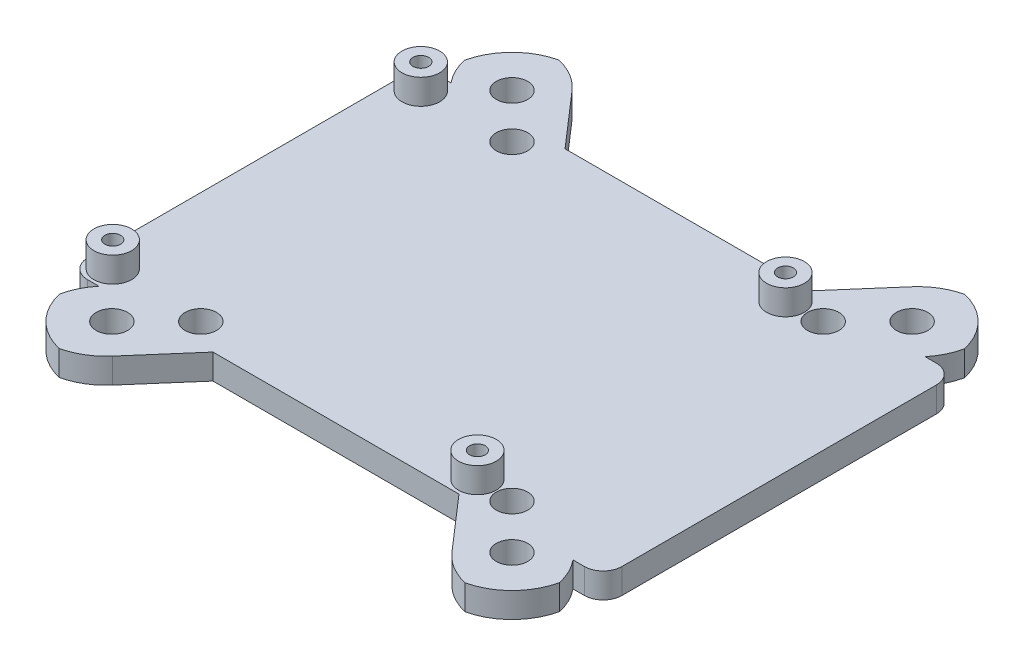
from build123d import *

# Parameters (mm, degrees)
SKETCH1_W           = 85
SKETCH1_H           = 56
SKETCH1_R           = 1.25
BOSS_EXTRUDE1_DEPTH = 4
SKETCH2_R           = 3
SKETCH2_R_2         = 1.25
BOSS_EXTRUDE2_DEPTH = 4
FILLET1_R           = 3
BOSS_EXTRUDE4_DEPTH = 4
SKETCH3_R           = 2.5
CUT_EXTRUDE1_DEPTH  = 59.5
FILLET2_R           = 10


with BuildPart() as part:
    # Sketch1 → Boss-Extrude1 (new body)
    with BuildSketch(Plane(origin=(0, 0, 0), x_dir=(1, 0, 0), z_dir=(0, 1, 0))):
        Rectangle(SKETCH1_W, SKETCH1_H)
        with Locations(Location((-39, 24.5, 0), (0, 0, 270))):
            Circle(SKETCH1_R, mode=Mode.SUBTRACT)
        with Locations(Location((-39, -24.5, 0), (0, 0, 270))):
            Circle(SKETCH1_R, mode=Mode.SUBTRACT)
        with Locations(Location((19, 24.5, 0), (0, 0, 270))):
            Circle(SKETCH1_R, mode=Mode.SUBTRACT)
        with Locations(Location((19, -24.5, 0), (0, 0, 270))):
            Circle(SKETCH1_R, mode=Mode.SUBTRACT)
    extrude(amount=BOSS_EXTRUDE1_DEPTH)

    # Sketch2 → Boss-Extrude2 (add)
    # profile 1 of 4: a face of its own
    with BuildSketch(Plane(origin=(0, 4, 0), x_dir=(1, 0, 0), z_dir=(0, 1, 0))):
        with Locations(Location((-39, 24.5, 0), (0, 0, 270))):
            Circle(SKETCH2_R)
        with Locations(Location((-39, 24.5, 0), (0, 0, 270))):
            Circle(SKETCH2_R_2, mode=Mode.SUBTRACT)
    # profile 2 of 4: a face of its own
    with BuildSketch(Plane(origin=(0, 4, 0), x_dir=(1, 0, 0), z_dir=(0, 1, 0))):
        with Locations(Location((19, 24.5, 0), (0, 0, 270))):
            Circle(SKETCH2_R)
        with Locations(Location((19, 24.5, 0), (0, 0, 270))):
            Circle(SKETCH2_R_2, mode=Mode.SUBTRACT)
    # profile 3 of 4: a face of its own
    with BuildSketch(Plane(origin=(0, 4, 0), x_dir=(1, 0, 0), z_dir=(0, 1, 0))):
        with Locations(Location((19, -24.5, 0), (0, 0, 270))):
            Circle(SKETCH2_R)
        with Locations(Location((19, -24.5, 0), (0, 0, 270))):
            Circle(SKETCH2_R_2, mode=Mode.SUBTRACT)
    # profile 4 of 4: a face of its own
    with BuildSketch(Plane(origin=(0, 4, 0), x_dir=(1, 0, 0), z_dir=(0, 1, 0))):
        with Locations(Location((-39, -24.5, 0), (0, 0, 270))):
            Circle(SKETCH2_R)
        with Locations(Location((-39, -24.5, 0), (0, 0, 270))):
            Circle(SKETCH2_R_2, mode=Mode.SUBTRACT)
    extrude(amount=BOSS_EXTRUDE2_DEPTH)

    # Fillet1
    fillet1_edges = [part.edges().sort_by_distance(p)[0] for p in [
        (-42.5, 2, 28),
        (-42.5, 2, -28),
        (42.5, 2, -28),
        (42.5, 2, 28),
    ]]
    fillet(fillet1_edges, radius=FILLET1_R)

    # Sketch5 → Boss-Extrude4 (add)
    with BuildSketch(Plane(origin=(0, 0, 0), x_dir=(1, 0, 0), z_dir=(0, 1, 0))):
        Polygon((-40, -30), (-17, -10), (-17, 10), (-40, 30), (-40, 40), (-30, 40), (-10, 17), (10, 17), (30, 40), (40, 40), (40, 30), (17, 10), (17, -10), (40, -30), (40, -40), (30, -40), (10, -17), (-10, -17), (-30, -40), (-40, -40), align=None)
    extrude(amount=BOSS_EXTRUDE4_DEPTH)

    # Sketch3 → Cut-Extrude1 (cut, through all)
    with BuildSketch(Plane(origin=(0, 4, 0), x_dir=(1, 0, 0), z_dir=(0, 1, 0))):
        with Locations(Location((-31.819805153, 31.819805153, 0), (0, 0, 270))):
            Circle(SKETCH3_R)
        with Locations(Location((-24.748737342, 24.748737342, 0), (0, 0, 270))):
            Circle(SKETCH3_R)
        with Locations(Location((31.819805153, 31.819805153, 0), (0, 0, 270))):
            Circle(SKETCH3_R)
        with Locations(Location((24.748737342, 24.748737342, 0), (0, 0, 270))):
            Circle(SKETCH3_R)
        with Locations(Location((24.748737342, -24.748737342, 0), (0, 0, 270))):
            Circle(SKETCH3_R)
        with Locations(Location((31.819805153, -31.819805153, 0), (0, 0, 270))):
            Circle(SKETCH3_R)
        with Locations(Location((-31.819805153, -31.819805153, 0), (0, 0, 270))):
            Circle(SKETCH3_R)
        with Locations(Location((-24.748737342, -24.748737342, 0), (0, 0, 270))):
            Circle(SKETCH3_R)
    extrude(amount=-CUT_EXTRUDE1_DEPTH, mode=Mode.SUBTRACT)

    # Fillet2
    # the kernel refuses this fillet: 10 mm, written as the material it takes off along each edge
    with BuildSketch(Plane(origin=(-40, -10.951097141, -30), x_dir=(0.7546055221635131, 0, 0.6561787149247771), z_dir=(0, 1, 0))) as fillet2_piece_1_section:
        with BuildLine():
            CenterArc((4.671704482, 9.8672905), FILLET2_R, 221.009086902, 39.646111147)
            Line((-2.87435074, 3.305503351), (-3.025271844, 3.174267608))
            Line((-3.025271844, 3.174267608), (-0.150921104, -0.131235743))
            Line((-0.150921104, -0.131235743), (0, -0.2))
            ThreePointArc((0, -0.2), (1.523975065, -0.2), (3.015475044, -0.19734581))
            Line((3.015475044, -0.19734581), (3.047950131, 0))
        make_face()
    fillet2_piece_1 = extrude(amount=25.902194282, mode=Mode.PRIVATE)
    fillet2_piece_1 = split(fillet2_piece_1, bisect_by=Plane(origin=(-39.506364614, 2, -28), z_dir=(0, 0, -1)), keep=Keep.TOP, mode=Mode.PRIVATE)
    add(fillet2_piece_1, mode=Mode.SUBTRACT)
    with BuildSketch(Plane(origin=(-40, -25, -40), x_dir=(0, 0, 1), z_dir=(0, 1, 0)), Plane(origin=(40, -25, -40), x_dir=(-1, 0, 0), z_dir=(0, 1, 0))) as fillet2_piece_2:
        with BuildLine():
            CenterArc((FILLET2_R, FILLET2_R), FILLET2_R, 180, 90)
            Line((0, FILLET2_R), (-FILLET2_R * 0.02, FILLET2_R))
            Line((-FILLET2_R * 0.02, FILLET2_R), (-FILLET2_R * 0.02, -FILLET2_R * 0.02))
            Line((-FILLET2_R * 0.02, -FILLET2_R * 0.02), (FILLET2_R, -FILLET2_R * 0.02))
            Line((FILLET2_R, -FILLET2_R * 0.02), (FILLET2_R, 0))
        make_face()
    extrude(amount=54, mode=Mode.SUBTRACT)
    with BuildSketch(Plane(origin=(-30, -11.390762292, -40), x_dir=(-1, 0, 0), z_dir=(0, 1, 0)), Plane(origin=(30, -11.390762292, -40), x_dir=(-0.6561787149247741, 0, 0.7546055221635154), z_dir=(0, 1, 0))) as fillet2_piece_3:
        with BuildLine():
            CenterArc((FILLET2_R * 0.455630491663, FILLET2_R), FILLET2_R, 221.009086902, 48.990913098)
            Line((-FILLET2_R * 0.2989750305, FILLET2_R * 0.343821285075), (-FILLET2_R * 0.314067140943, FILLET2_R * 0.330697710777))
            Line((-FILLET2_R * 0.314067140943, FILLET2_R * 0.330697710777), (-FILLET2_R * 0.00911260983327, -FILLET2_R * 0.02))
            Line((-FILLET2_R * 0.00911260983327, -FILLET2_R * 0.02), (FILLET2_R * 0.455630491663, -FILLET2_R * 0.02))
            Line((FILLET2_R * 0.455630491663, -FILLET2_R * 0.02), (FILLET2_R * 0.455630491663, 0))
        make_face()
    extrude(amount=26.781524583, mode=Mode.SUBTRACT)
    with BuildSketch(Plane(origin=(40, -10.951097141, -30), x_dir=(0, 0, -1), z_dir=(0, 1, 0))) as fillet2_piece_4_section:
        with BuildLine():
            CenterArc((4.380438856, 10), FILLET2_R, 230.353888853, 39.646111147)
            Line((-2, 2.3), (-2.127608777, 2.146))
            ThreePointArc((-2.127608777, 2.146), (-1.150921104, 1.018764257), (-0.150921104, -0.131235743))
            Line((-0.150921104, -0.131235743), (0, -0.2))
            Line((0, -0.2), (4.380438856, -0.2))
            Line((4.380438856, -0.2), (4.380438856, 0))
        make_face()
    fillet2_piece_4 = extrude(amount=25.902194282, mode=Mode.PRIVATE)
    fillet2_piece_4 = split(fillet2_piece_4, bisect_by=Plane(origin=(39.506364614, 2, -28), z_dir=(0, 0, -1)), keep=Keep.TOP, mode=Mode.PRIVATE)
    add(fillet2_piece_4, mode=Mode.SUBTRACT)
    with BuildSketch(Plane(origin=(40, -10.951097141, 30), x_dir=(0, 0, 1), z_dir=(0, 1, 0))) as fillet2_piece_5_section:
        with BuildLine():
            CenterArc((4.380438856, -10), FILLET2_R, 90, 39.646111147)
            Line((-2, -2.3), (-2.127608777, -2.146))
            ThreePointArc((-2.127608777, -2.146), (-1.150921104, -1.018764257), (-0.150921104, 0.131235743))
            Line((-0.150921104, 0.131235743), (0, 0.2))
            Line((0, 0.2), (4.380438856, 0.2))
            Line((4.380438856, 0.2), (4.380438856, 0))
        make_face()
    fillet2_piece_5 = extrude(amount=25.902194282, mode=Mode.PRIVATE)
    fillet2_piece_5 = split(fillet2_piece_5, bisect_by=Plane(origin=(39.506364614, 2, 28), z_dir=(0, 0, 1)), keep=Keep.TOP, mode=Mode.PRIVATE)
    add(fillet2_piece_5, mode=Mode.SUBTRACT)
    with BuildSketch(Plane(origin=(40, -25, 40), x_dir=(-1, 0, 0), z_dir=(0, 1, 0)), Plane(origin=(-40, -25, 40), x_dir=(0, 0, -1), z_dir=(0, 1, 0))) as fillet2_piece_6:
        with BuildLine():
            CenterArc((FILLET2_R, -FILLET2_R), FILLET2_R, 90, 90)
            Line((0, -FILLET2_R), (-FILLET2_R * 0.02, -FILLET2_R))
            Line((-FILLET2_R * 0.02, -FILLET2_R), (-FILLET2_R * 0.02, FILLET2_R * 0.02))
            Line((-FILLET2_R * 0.02, FILLET2_R * 0.02), (FILLET2_R, FILLET2_R * 0.02))
            Line((FILLET2_R, FILLET2_R * 0.02), (FILLET2_R, 0))
        make_face()
    extrude(amount=54, mode=Mode.SUBTRACT)
    with BuildSketch(Plane(origin=(30, -11.390762292, 40), x_dir=(-0.6561787149247873, 0, -0.7546055221635042), z_dir=(0, 1, 0)), Plane(origin=(-30, -11.390762292, 40), x_dir=(-1, 0, 0), z_dir=(0, 1, 0))) as fillet2_piece_7:
        with BuildLine():
            CenterArc((FILLET2_R * 0.455630491663, -FILLET2_R), FILLET2_R, 90, 48.990913098)
            Line((-FILLET2_R * 0.2989750305, -FILLET2_R * 0.343821285075), (-FILLET2_R * 0.314067140943, -FILLET2_R * 0.330697710777))
            Line((-FILLET2_R * 0.314067140943, -FILLET2_R * 0.330697710777), (-FILLET2_R * 0.00911260983327, FILLET2_R * 0.02))
            Line((-FILLET2_R * 0.00911260983327, FILLET2_R * 0.02), (FILLET2_R * 0.455630491663, FILLET2_R * 0.02))
            Line((FILLET2_R * 0.455630491663, FILLET2_R * 0.02), (FILLET2_R * 0.455630491663, 0))
        make_face()
    extrude(amount=26.781524583, mode=Mode.SUBTRACT)
    with BuildSketch(Plane(origin=(-40, -10.951097141, 30), x_dir=(0.7546055221635047, 0, -0.6561787149247865), z_dir=(0, 1, 0))) as fillet2_piece_8_section:
        with BuildLine():
            CenterArc((4.671704482, -9.8672905), FILLET2_R, 99.344801951, 39.646111147)
            Line((-2.87435074, -3.305503351), (-3.025271844, -3.174267608))
            Line((-3.025271844, -3.174267608), (-0.150921104, 0.131235743))
            Line((-0.150921104, 0.131235743), (0, 0.2))
            ThreePointArc((0, 0.2), (1.523975065, 0.2), (3.015475044, 0.19734581))
            Line((3.015475044, 0.19734581), (3.047950131, 0))
        make_face()
    fillet2_piece_8 = extrude(amount=25.902194282, mode=Mode.PRIVATE)
    fillet2_piece_8 = split(fillet2_piece_8, bisect_by=Plane(origin=(-39.506364614, 2, 28), z_dir=(0, 0, 1)), keep=Keep.TOP, mode=Mode.PRIVATE)
    add(fillet2_piece_8, mode=Mode.SUBTRACT)


solid = part.part
